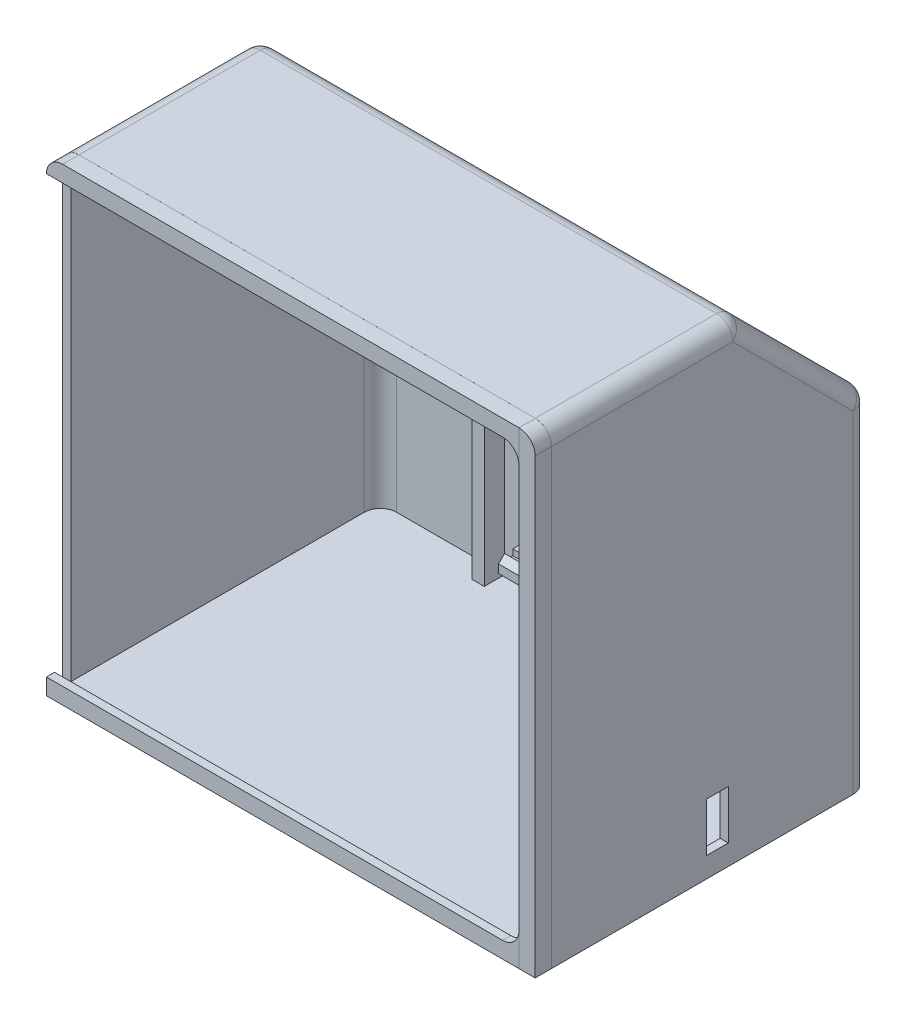
from build123d import *

# Parameters (mm, degrees)
EXTRUDE_2_DEPTH     = 120
CUT_EXTRUDE_START   = -2
CUT_EXTRUDE_2_DEPTH = 116
SKETCH_2_W          = 71.3
SKETCH_2_H          = 24.5
SKETCH_2_W_2        = 3.5
SKETCH_2_H_2        = 28
CUT_EXTRUDE_1_DEPTH = 2
EXTRUDE_START       = -28.5
EXTRUDE_4_DEPTH     = 8
SKETCH_6_R          = 3.25
EXTRUDE_5_DEPTH     = 4.9
SKETCH_7_R          = 2.05
CUT_EXTRUDE_3_DEPTH = 5
SKETCH_14_R         = 3.35
EXTRUDE_6_DEPTH     = 5
SKETCH_15_R         = 2.05
CUT_EXTRUDE_4_DEPTH = 4.7
SKETCH_17_W         = 5.4
SKETCH_17_H         = 12
CUT_EXTRUDE_5_DEPTH = 2
EXTRUDE_START_2     = -1.5
EXTRUDE_8_DEPTH     = 8
SKETCH_19_W         = 2.013039569
SKETCH_19_H         = 115
CUT_EXTRUDE_6_DEPTH = 167.162393413
EXTRUDE_START_3     = -2
EXTRUDE_12_DEPTH    = 118
EXTRUDE_12_2_DEPTH  = 118
EXTRUDE_13_DEPTH    = 115
SKETCH_23_W         = 13.65
SKETCH_23_H         = 38.15
SKETCH_23_W_2       = 7.65
SKETCH_23_H_2       = 32.15
EXTRUDE_14_DEPTH    = 12.9
FILLET_1_R          = 4
FILLET_2_R          = 4
FILLET_3_R          = 4
CUT_EXTRUDE_7_DEPTH = 14
SKETCH_25_W         = 3
SKETCH_25_H         = 82.366218896
EXTRUDE_15_DEPTH    = 5
SKETCH_29_W         = 3
SKETCH_29_H         = 110.971238899
EXTRUDE_16_DEPTH    = 5
FILLET_4_R          = 4
FILLET_5_R          = 4


with BuildPart() as part:
    # Эскиз1 → Бобышка-Вытянуть2 (new body)
    with BuildSketch(Plane(origin=(0, 0, 0), x_dir=(0, 0, -1), z_dir=(1, 0, 0))):
        Polygon((-73.62825176, 26.745699666), (-25.448056913, 26.745699666), (6.37174824, -5.074105488), (6.37174824, -88.254300334), (-73.62825176, -88.254300334), align=None)
    extrude(amount=EXTRUDE_2_DEPTH)

    # Эскиз4 → Вырез-Вытянуть2 (cut)
    with BuildSketch(Plane(origin=(120, 0, 0), x_dir=(0, 0, -1), z_dir=(1, 0, 0)).offset(CUT_EXTRUDE_START)):
        Polygon((-71.62825176, 24.745699666), (-71.62825176, -86.254300334), (4.37174824, -86.254300334), (4.37174824, -5.902532612), (-26.276484038, 24.745699666), align=None)
    extrude(amount=-CUT_EXTRUDE_2_DEPTH, mode=Mode.SUBTRACT)

    # Эскиз2 → Вырез-Вытянуть1 (cut)
    with BuildSketch(Plane(origin=(0, 0.648821376, -0.648821376), x_dir=(1, 0, 0), z_dir=(0, 0.7071067811865462, -0.7071067811865488))):
        with Locations((76.35, -14.406559212)):
            Rectangle(SKETCH_2_W, SKETCH_2_H)
        with Locations((20.35, -14.406559212)):
            Rectangle(SKETCH_2_W_2, SKETCH_2_H_2)
    extrude(amount=-CUT_EXTRUDE_1_DEPTH, mode=Mode.SUBTRACT)


with BuildPart() as extrude_4_tool:
    # Эскиз5 → Бобышка-Вытянуть4 (new body)
    with BuildSketch(Plane(origin=(120, 0, 0), x_dir=(0, 0, -1), z_dir=(1, 0, 0)).offset(EXTRUDE_START)):
        Polygon((0.37174824, -30.954300334), (0.37174824, -32.454300334), (4.37174824, -32.454300334), (4.37174824, -28.954300334), (-3.12825176, -28.954300334), (-3.12825176, -30.987914491), (-1.62825176, -32.454300334), (-1.62825176, -30.954300334), align=None)
        Polygon((-3.12826176, -79.254300334), (4.37173824, -79.254300334), (4.37173824, -75.754300334), (0.37173824, -75.754300334), (0.37173824, -77.254300334), (-1.62826176, -77.254300334), (-1.62826176, -75.754300334), (-3.12826176, -77.224733598), align=None)
    extrude(amount=-EXTRUDE_4_DEPTH)


with BuildPart() as part_1:
    add(part.part)


with BuildPart() as part_2:
    # Бобышка-Вытянуть4: joined with extrude_4_tool
    add(part_1.part.fuse(extrude_4_tool.part, tol=0.00001))

    # Эскиз6 → Бобышка-Вытянуть5 (add)
    with BuildSketch(Plane(origin=(0, -0.765392186, 0.765392186), x_dir=(1, 0, 0), z_dir=(0, -0.7071067811865477, 0.7071067811865475))):
        with Locations(Location((38.85, 29.906559212, 0), (0, 0, 90))):
            Circle(SKETCH_6_R)
        with Locations(Location((113.85, 29.906559212, 0), (0, 0, 90))):
            Circle(SKETCH_6_R)
        with Locations(Location((38.85, -1.093440788, 0), (0, 0, 90))):
            Circle(SKETCH_6_R)
        with Locations(Location((113.85, -1.093440788, 0), (0, 0, 90))):
            Circle(SKETCH_6_R)
    extrude(amount=EXTRUDE_5_DEPTH)

    # Эскиз7 → Вырез-Вытянуть3 (cut)
    with BuildSketch(Plane(origin=(0, -4.230215414, 4.230215414), x_dir=(1, 0, 0), z_dir=(0, -0.7071067811865476, 0.7071067811865476))):
        with Locations(Location((38.85, 29.906559212, 0), (0, 0, 270))):
            Circle(SKETCH_7_R)
        with Locations(Location((113.85, 29.906559212, 0), (0, 0, 270))):
            Circle(SKETCH_7_R)
        with Locations(Location((113.85, -1.093440788, 0), (0, 0, 270))):
            Circle(SKETCH_7_R)
        with Locations(Location((38.85, -1.093440788, 0), (0, 0, 270))):
            Circle(SKETCH_7_R)
    extrude(amount=-CUT_EXTRUDE_3_DEPTH, mode=Mode.SUBTRACT)

    # Эскиз14 → Бобышка-Вытянуть6 (add)
    with BuildSketch(Plane.ZY.offset(-118)):
        with Locations(Location((16.84825176, -74.444300334, 0), (0, 0, 180))):
            Circle(SKETCH_14_R)
        with Locations(Location((16.84825176, -21.444300334, 0), (0, 0, 180))):
            Circle(SKETCH_14_R)
    extrude(amount=EXTRUDE_6_DEPTH)

    # Эскиз15 → Вырез-Вытянуть4 (cut)
    with BuildSketch(Plane.ZY.offset(-113)):
        with Locations((16.84825176, -21.444300334)):
            Circle(SKETCH_15_R)
        with Locations((16.84825176, -74.444300334)):
            Circle(SKETCH_15_R)
    extrude(amount=-CUT_EXTRUDE_4_DEPTH, mode=Mode.SUBTRACT)

    # Эскиз17 → Вырез-Вытянуть5 (cut)
    with BuildSketch(Plane(origin=(120, 0, 0), x_dir=(0, 0, -1), z_dir=(1, 0, 0))):
        with Locations((-30.92825176, -77.254300334)):
            Rectangle(SKETCH_17_W, SKETCH_17_H)
    extrude(amount=-CUT_EXTRUDE_5_DEPTH, mode=Mode.SUBTRACT)

    # Эскиз18 → Бобышка-Вытянуть8 (add)
    with BuildSketch(Plane(origin=(40, 0, 0), x_dir=(0, 0, -1), z_dir=(1, 0, 0)).offset(EXTRUDE_START_2)):
        Polygon((0.37174824, -30.954300334), (0.37174824, -32.454300334), (4.37174824, -32.454300334), (4.37174824, -28.954300334), (-3.12825176, -28.954300334), (-3.12825176, -31.133921423), (-1.62825176, -32.454300334), (-1.62825176, -30.954300334), align=None)
        Polygon((-3.12825176, -79.254300334), (4.37174824, -79.254300334), (4.37174824, -75.754300334), (0.37174824, -75.754300334), (0.37174824, -77.254300334), (-1.62825176, -77.254300334), (-1.62825176, -75.754300334), (-3.12825176, -77.217054443), align=None)
    extrude(amount=EXTRUDE_8_DEPTH)

    # Эскиз19 → Вырез-Вытянуть6 (cut, through all)
    with BuildSketch(Plane(origin=(120, 0, 0), x_dir=(0, 0, -1), z_dir=(1, 0, 0))):
        with Locations((-72.621731975, -30.754300334)):
            Rectangle(SKETCH_19_W, SKETCH_19_H)
    extrude(amount=-CUT_EXTRUDE_6_DEPTH, mode=Mode.SUBTRACT)

    # Эскиз23 → Бобышка-Вытянуть14 (add)
    with BuildSketch(Plane(origin=(0, -0.765392186, 0.765392186), x_dir=(1, 0, 0), z_dir=(0, -0.7071067811865477, 0.7071067811865475))):
        with Locations((20.35, 14.406559212)):
            Rectangle(SKETCH_23_W, SKETCH_23_H)
        with Locations((20.35, 14.406559212)):
            Rectangle(SKETCH_23_W_2, SKETCH_23_H_2, mode=Mode.SUBTRACT)
    extrude(amount=EXTRUDE_14_DEPTH)

    # Скругление1
    fillet_1_edges = [part_2.edges().sort_by_distance(p)[0] for p in [
        (120, -46.664202911, -6.37174824),
        (120, 10.835797089, 9.538154336),
        (120, 26.745699666, 48.531634552),
        (0, 26.745699666, 48.531634552),
        (0, 10.835797089, 9.538154336),
        (0, -46.664202911, -6.37174824),
        (60, 26.745699666, 25.448056913),
        (60, -5.074105488, -6.37174824),
    ]]
    fillet(fillet_1_edges, radius=FILLET_1_R)

    # Скругление2
    # the kernel refuses this fillet: 4 mm, written as the material it adds along each edge
    with BuildSketch(Plane(origin=(6, 20.745699666, 27.933338287), x_dir=(0, 0.7071067811865476, -0.7071067811865476), z_dir=(-1, 0, 0))) as fillet_2_piece_1_section:
        Polygon((0, 0), (FILLET_2_R * 1.02, 0), (FILLET_2_R * 1.02, -FILLET_2_R * 0.422497833621), (FILLET_2_R * 0.72124891681, -FILLET_2_R * 0.72124891681), align=None)
    fillet_2_piece_1 = extrude(amount=FILLET_2_R * 1.02, mode=Mode.PRIVATE)
    fillet_2_piece_1 = fillet_2_piece_1 - Plane(origin=(6, 20.745699666, 27.933338287), x_dir=(0, -0.9238795325112867, 0.3826834323650897), z_dir=(-1, 0, 0)) * Sphere(FILLET_2_R, mode=Mode.PRIVATE)
    add(fillet_2_piece_1)
    with BuildSketch(Plane(origin=(6, -7.559386862, -0.37174824), x_dir=(0, 0, -1), z_dir=(-1, 0, 0))) as fillet_2_piece_2_section:
        Polygon((0, 0), (FILLET_2_R * 1.02, 0), (FILLET_2_R * 1.02, -FILLET_2_R * 0.422497833621), (FILLET_2_R * 0.72124891681, -FILLET_2_R * 0.72124891681), align=None)
    fillet_2_piece_2 = extrude(amount=FILLET_2_R * 1.02, mode=Mode.PRIVATE)
    fillet_2_piece_2 = fillet_2_piece_2 - Plane(origin=(6, -7.559386862, -0.37174824), x_dir=(0, -0.3826834323650898, 0.9238795325112867), z_dir=(-1, 0, 0)) * Sphere(FILLET_2_R, mode=Mode.PRIVATE)
    add(fillet_2_piece_2)
    with BuildSketch(Plane(origin=(114, -7.559386862, -0.37174824), x_dir=(0, 0.7071067811865476, -0.7071067811865476), z_dir=(1, 0, 0))) as fillet_2_piece_3_section:
        Polygon((0, 0), (FILLET_2_R * 1.02, 0), (FILLET_2_R * 1.02, -FILLET_2_R * 0.422497833621), (FILLET_2_R * 0.72124891681, -FILLET_2_R * 0.72124891681), align=None)
    fillet_2_piece_3 = extrude(amount=FILLET_2_R * 1.02, mode=Mode.PRIVATE)
    fillet_2_piece_3 = fillet_2_piece_3 - Plane(origin=(114, -7.559386862, -0.37174824), x_dir=(0, -0.3826834323650898, 0.9238795325112867), z_dir=(1, 0, 0)) * Sphere(FILLET_2_R, mode=Mode.PRIVATE)
    add(fillet_2_piece_3)
    with BuildSketch(Plane(origin=(114, 20.745699666, 27.933338287), x_dir=(0, 0.7071067811865476, -0.7071067811865476), z_dir=(1, 0, 0))) as fillet_2_piece_4_section:
        Polygon((0, 0), (FILLET_2_R * 1.02, 0), (FILLET_2_R * 1.02, FILLET_2_R * 0.422497833621), (FILLET_2_R * 0.72124891681, FILLET_2_R * 0.72124891681), align=None)
    fillet_2_piece_4 = extrude(amount=FILLET_2_R * 1.02, mode=Mode.PRIVATE)
    fillet_2_piece_4 = fillet_2_piece_4 - Plane(origin=(114, 20.745699666, 27.933338287), x_dir=(0, -0.9238795325112867, 0.3826834323650897), z_dir=(1, 0, 0)) * Sphere(FILLET_2_R, mode=Mode.PRIVATE)
    add(fillet_2_piece_4)
    with BuildSketch(Plane(origin=(2, 24.745699666, 27.933338287), x_dir=(1, 0, 0), z_dir=(0, 0, 1))) as fillet_2_piece_5:
        with BuildLine():
            CenterArc((FILLET_2_R, -FILLET_2_R), FILLET_2_R, 90, 90)
            Line((0, -FILLET_2_R), (0, 0))
            Line((0, 0), (FILLET_2_R, 0))
        make_face()
    extrude(amount=43.681873903)
    with BuildSketch(Plane(origin=(2, -86.254300334, -4.37174824), x_dir=(0, 0, 1), z_dir=(0, 1, 0))) as fillet_2_piece_6:
        with BuildLine():
            CenterArc((FILLET_2_R, FILLET_2_R), FILLET_2_R, 180, 90)
            Line((0, FILLET_2_R), (0, 0))
            Line((0, 0), (FILLET_2_R, 0))
        make_face()
    extrude(amount=78.694913472)
    with BuildSketch(Plane(origin=(2, -4.730959737, -3.200175365), x_dir=(0, -0.7071067811865476, 0.7071067811865476), z_dir=(0, 0.7071067811865476, 0.7071067811865476))) as fillet_2_piece_7:
        with BuildLine():
            CenterArc((FILLET_2_R, FILLET_2_R), FILLET_2_R, 180, 90)
            Line((0, FILLET_2_R), (0, 0))
            Line((0, 0), (FILLET_2_R, 0))
        make_face()
    extrude(amount=40.029437252)
    with BuildSketch(Plane(origin=(118, -86.254300334, -4.37174824), x_dir=(0, 0, 1), z_dir=(0, 1, 0))) as fillet_2_piece_8:
        with BuildLine():
            CenterArc((FILLET_2_R, -FILLET_2_R), FILLET_2_R, 90, 90)
            Line((0, -FILLET_2_R), (0, 0))
            Line((0, 0), (FILLET_2_R, 0))
        make_face()
    extrude(amount=78.694913472)
    with BuildSketch(Plane(origin=(114, -5.902532612, -4.37174824), x_dir=(0, 0.7071067811865477, 0.7071067811865475), z_dir=(-1, 0, 0)), Plane(origin=(114, 24.745699666, 26.276484038), x_dir=(0, 0, 1), z_dir=(-1, 0, 0))) as fillet_2_piece_9:
        with BuildLine():
            CenterArc((FILLET_2_R * 0.414213562373, -FILLET_2_R), FILLET_2_R, 90, 45)
            Line((-FILLET_2_R * 0.292893218813, -FILLET_2_R * 0.292893218813), (0, 0))
            Line((0, 0), (FILLET_2_R * 0.414213562373, 0))
        make_face()
    extrude(amount=108)
    with BuildSketch(Plane(origin=(118, -4.730959737, -3.200175365), x_dir=(0, -0.7071067811865476, 0.7071067811865476), z_dir=(0, 0.7071067811865476, 0.7071067811865476))) as fillet_2_piece_10_section:
        with BuildLine():
            CenterArc((FILLET_2_R, -FILLET_2_R), FILLET_2_R, 90, 90)
            Line((0, -FILLET_2_R), (0, 0))
            Line((0, 0), (FILLET_2_R, 0))
        make_face()
    fillet_2_piece_10 = extrude(amount=40.029437252, mode=Mode.PRIVATE)
    fillet_2_piece_10 = fillet_2_piece_10 - Plane(origin=(113.85, -2.201441794, 0.655083003), x_dir=(0, -0.7071067811865476, -0.7071067811865476), z_dir=(0, -0.7071067811865476, 0.7071067811865476)) * Cylinder(2.05, 97, mode=Mode.PRIVATE)
    fillet_2_piece_10 = fillet_2_piece_10 - Plane(origin=(113.85, 19.718868422, 22.57539322), x_dir=(0, -0.7071067811865476, -0.7071067811865476), z_dir=(0, -0.7071067811865476, 0.7071067811865476)) * Cylinder(2.05, 97, mode=Mode.PRIVATE)
    add(fillet_2_piece_10)
    with BuildSketch(Plane(origin=(118, 24.745699666, 27.933338287), x_dir=(-1, 0, 0), z_dir=(0, 0, 1))) as fillet_2_piece_11:
        with BuildLine():
            CenterArc((FILLET_2_R, FILLET_2_R), FILLET_2_R, 180, 90)
            Line((0, FILLET_2_R), (0, 0))
            Line((0, 0), (FILLET_2_R, 0))
        make_face()
    extrude(amount=43.681873903)

    # Эскиз24 → Вырез-Вытянуть7 (cut)
    with BuildSketch(Plane.ZY.offset(-13.525)):
        Polygon((0.976244749, -2.272595882), (9.238894097, -10.535245229), (9.818018196, -9.956121131), (1.555368848, -1.693471783), align=None)
    extrude(amount=-CUT_EXTRUDE_7_DEPTH, mode=Mode.SUBTRACT)

    # Эскиз25 → Бобышка-Вытянуть15 (add)
    with BuildSketch(Plane.XY.offset(-4.37174824)):
        with Locations((31, -45.071190886)):
            Rectangle(SKETCH_25_W, SKETCH_25_H)
    extrude(amount=EXTRUDE_15_DEPTH)

    # Эскиз29 → Бобышка-Вытянуть16 (add)
    with BuildSketch(Plane.ZY.offset(-118)):
        with Locations((38.12825176, -30.768680885)):
            Rectangle(SKETCH_29_W, SKETCH_29_H)
    extrude(amount=EXTRUDE_16_DEPTH)


with BuildPart() as body_2:
    # Эскиз20 → Бобышка-Вытянуть12 (new, through all)
    with BuildSketch(Plane(origin=(120, 0, 0), x_dir=(0, 0, -1), z_dir=(1, 0, 0)).offset(EXTRUDE_START_3)):
        Polygon((-71.616212191, -86.255119774), (-73.616212191, -86.255119774), (-73.616212191, -84.255119774), (-75.623732482, -84.255119774), (-75.623732482, -88.252193395), (-71.616212191, -88.252193395), align=None)
    extrude(amount=-EXTRUDE_12_DEPTH)


with BuildPart() as body_3:
    # Эскиз20 → Extrude 12 2 (new, through all)
    with BuildSketch(Plane(origin=(120, 0, 0), x_dir=(0, 0, -1), z_dir=(1, 0, 0)).offset(EXTRUDE_START_3)):
        Polygon((-71.616212191, 24.744441667), (-73.616212191, 24.744441667), (-73.616212191, 22.744441667), (-75.623732482, 22.744441667), (-75.623732482, 26.744441667), (-71.616212191, 26.744441667), align=None)
    extrude(amount=-EXTRUDE_12_2_DEPTH)


    add(body_2.part)  # Бобышка-Вытянуть13 merges body 2
    # Эскиз22 → Бобышка-Вытянуть13 (add, through all)
    with BuildSketch(Plane.XZ.offset(88.254300334)):
        Polygon((120, 71.615212191), (120, 75.629666128), (116.000004401, 75.623732482), (116.000004401, 73.619972336), (118, 73.619972336), (118, 71.616212191), align=None)
    extrude(amount=-EXTRUDE_13_DEPTH)

    # Скругление3
    # the kernel refuses this fillet: 4 mm, written as the material it takes off along each edge
    with BuildSketch(Plane(origin=(120, 26.745699666, 61.615212191), x_dir=(0, -1, 0), z_dir=(0, 0, 1))) as fillet_3_piece_1:
        with BuildLine():
            CenterArc((FILLET_3_R, -FILLET_3_R), FILLET_3_R, 90, 90)
            Line((0, -FILLET_3_R), (0, 0))
            Line((0, 0), (FILLET_3_R, 0))
        make_face()
    extrude(amount=24.014453937, mode=Mode.SUBTRACT)
    with BuildSketch(Plane(origin=(0, 26.744441667, 85.623732482), x_dir=(0, -1, 0), z_dir=(0, 0, -1))) as fillet_3_piece_2:
        with BuildLine():
            CenterArc((FILLET_3_R, -FILLET_3_R), FILLET_3_R, 90, 90)
            Line((0, -FILLET_3_R), (0, 0))
            Line((0, 0), (FILLET_3_R, 0))
        make_face()
    extrude(amount=24.007520291, mode=Mode.SUBTRACT)

    # Скругление4
    fillet_4_edges = [body_3.edges().sort_by_distance(p)[0] for p in [
        (118, 24.744441667, 72.616212191),
    ]]
    fillet(fillet_4_edges, radius=FILLET_4_R)

    # Скругление5
    fillet_5_edges = [body_3.edges().sort_by_distance(p)[0] for p in [
        (116.000004401, 22.744441667, 74.621852409),
        (116.000004401, -84.255119774, 74.621852409),
    ]]
    fillet(fillet_5_edges, radius=FILLET_5_R)


solid = Compound([part_2.part, body_3.part])
